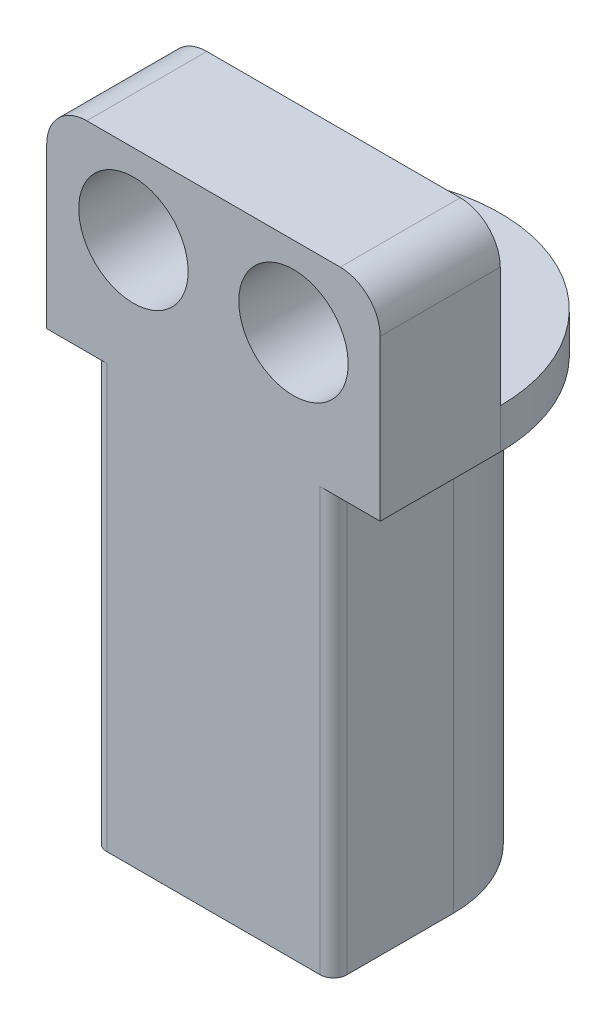
from build123d import *
from build123d.topology import SkipClean

# Parameters (mm, degrees)
SKETCH_1_R          = 7.6
EXTRUDE_1_DEPTH     = 5
SKETCH_2_W          = 18
SKETCH_2_H          = 5
EXTRUDE_2_DEPTH     = 15
EXTRUDE_3_DEPTH     = 3
SKETCH_5_W          = 3.5
SKETCH_5_H          = 5
EXTRUDE_4_DEPTH     = 12
SKETCH_3_R          = 4.1
CUT_EXTRUDE_1_DEPTH = 32.913946794
FILLET_4_R          = 1
SKETCH_6_W          = 25
SKETCH_6_H          = 12
SKETCH_6_R          = 4.1
EXTRUDE_5_DEPTH     = 4
FILLET_5_R          = 3
SKETCH_7_R          = 8.4
EXTRUDE_6_DEPTH     = 26.7
SKETCH_9_R          = 8.4
EXTRUDE_8_DEPTH     = 31.7
SKETCH_10_R         = 2.05
CUT_EXTRUDE_2_DEPTH = 5


with BuildPart() as part:
    # ｽｹｯﾁ1 → ﾎﾞｽ - 押し出し1 (new body)
    with BuildSketch(Plane(origin=(0, 0, 0), x_dir=(1, 0, 0), z_dir=(0, 1, 0))):
        with BuildLine():
            Line((-9, 0), (-9, -9))
            Line((-9, -9), (9, -9))
            Line((9, -9), (9, 0))
            ThreePointArc((9, 0), (0, 9), (-9, 0))
        make_face()
        with Locations(Location((0, 0, 0), (0, 0, 270))):
            Circle(SKETCH_1_R, mode=Mode.SUBTRACT)
    extrude(amount=EXTRUDE_1_DEPTH)

    # ｽｹｯﾁ2 → ﾎﾞｽ - 押し出し2 (add)
    with BuildSketch(Plane(origin=(0, 5, 0), x_dir=(1, 0, 0), z_dir=(0, 1, 0))):
        with Locations((0, -6.5)):
            Rectangle(SKETCH_2_W, SKETCH_2_H)
    extrude(amount=EXTRUDE_2_DEPTH)

    # ｽｹｯﾁ4 → ﾎﾞｽ - 押し出し3 (add)
    with BuildSketch(Plane(origin=(0, 5, 0), x_dir=(1, 0, 0), z_dir=(0, 1, 0))):
        with BuildLine():
            Line((-12.5, 0), (-12.5, -9))
            Line((-12.5, -9), (12.5, -9))
            Line((12.5, -9), (12.5, 0))
            ThreePointArc((12.5, 0), (0, 12.5), (-12.5, 0))
        make_face()
    extrude(amount=EXTRUDE_3_DEPTH)

    # ｽｹｯﾁ5 → ﾎﾞｽ - 押し出し4 (add)
    with BuildSketch(Plane(origin=(0, 8, 0), x_dir=(1, 0, 0), z_dir=(0, 1, 0))):
        with Locations((-10.75, -6.5)):
            Rectangle(SKETCH_5_W, SKETCH_5_H)
        with Locations((10.75, -6.5)):
            Rectangle(SKETCH_5_W, SKETCH_5_H)
    extrude(amount=EXTRUDE_4_DEPTH)

    # ｽｹｯﾁ3 → ｶｯﾄ - 押し出し1 (cut, through all)
    with BuildSketch(Plane.XY.offset(9)):
        with Locations((-6, 14)):
            Circle(SKETCH_3_R)
        with Locations((6, 14)):
            Circle(SKETCH_3_R)
    extrude(amount=-CUT_EXTRUDE_1_DEPTH, mode=Mode.SUBTRACT)

    # ﾌｨﾚｯﾄ4
    fillet_4_edges = [part.edges().sort_by_distance(p)[0] for p in [
        (9, 2.5, 9),
        (-9, 2.5, 9),
    ]]
    fillet(fillet_4_edges, radius=FILLET_4_R)

    # ｽｹｯﾁ6 → ﾎﾞｽ - 押し出し5 (add)
    with SkipClean():  # the faces are left unmerged after this step: merging them gives an invalid solid
        with BuildSketch(Plane(origin=(0, 0, 4), x_dir=(-1, 0, 0), z_dir=(0, 0, -1))):
            with Locations((0, 14)):
                Rectangle(SKETCH_6_W, SKETCH_6_H)
            with Locations((-6, 14)):
                Circle(SKETCH_6_R, mode=Mode.SUBTRACT)
            with Locations(Location((6, 14, 0), (0, 0, 180))):
                Circle(SKETCH_6_R, mode=Mode.SUBTRACT)
        extrude(amount=EXTRUDE_5_DEPTH)
    add(part.part.scale(1), mode=Mode.REPLACE)  # the faces are merged on a copy

    # ﾌｨﾚｯﾄ5
    fillet_5_edges = [part.edges().sort_by_distance(p)[0] for p in [
        (-12.5, 20, 4.5),
        (12.5, 20, 4.5),
    ]]
    fillet(fillet_5_edges, radius=FILLET_5_R)

    # ｽｹｯﾁ7 → ﾎﾞｽ - 押し出し6 (add)
    with SkipClean():  # the faces are left unmerged after this step: merging them gives an invalid solid
        with BuildSketch(Plane.XZ):
            with BuildLine():
                Line((8, 9), (-8, 9))
                ThreePointArc((-8, 9), (-8.707106781, 8.707106781), (-9, 8))
                Line((-9, 8), (-9, 0))
                ThreePointArc((-9, 0), (0, -9), (9, 0))
                Line((9, 0), (9, 8))
                ThreePointArc((9, 8), (8.707106781, 8.707106781), (8, 9))
            make_face()
            with Locations(Location((0, 0, 0), (0, 0, 270))):
                Circle(SKETCH_7_R, mode=Mode.SUBTRACT)
        extrude(amount=EXTRUDE_6_DEPTH)

    # ｽｹｯﾁ9 → ﾎﾞｽ - 押し出し8 (add)
    with SkipClean():  # the faces are left unmerged after this step: merging them gives an invalid solid
        with BuildSketch(Plane.XZ.offset(-5)):
            Circle(SKETCH_9_R)
        extrude(amount=EXTRUDE_8_DEPTH)

    # ｽｹｯﾁ10 → ｶｯﾄ - 押し出し2 (cut)
    with SkipClean():  # the faces are left unmerged after this step: merging them gives an invalid solid
        with BuildSketch(Plane.XZ.offset(26.7)):
            with Locations(Location((0, 0, 0), (0, 0, 270))):
                Circle(SKETCH_10_R)
        extrude(amount=-CUT_EXTRUDE_2_DEPTH, mode=Mode.SUBTRACT)


solid = part.part
